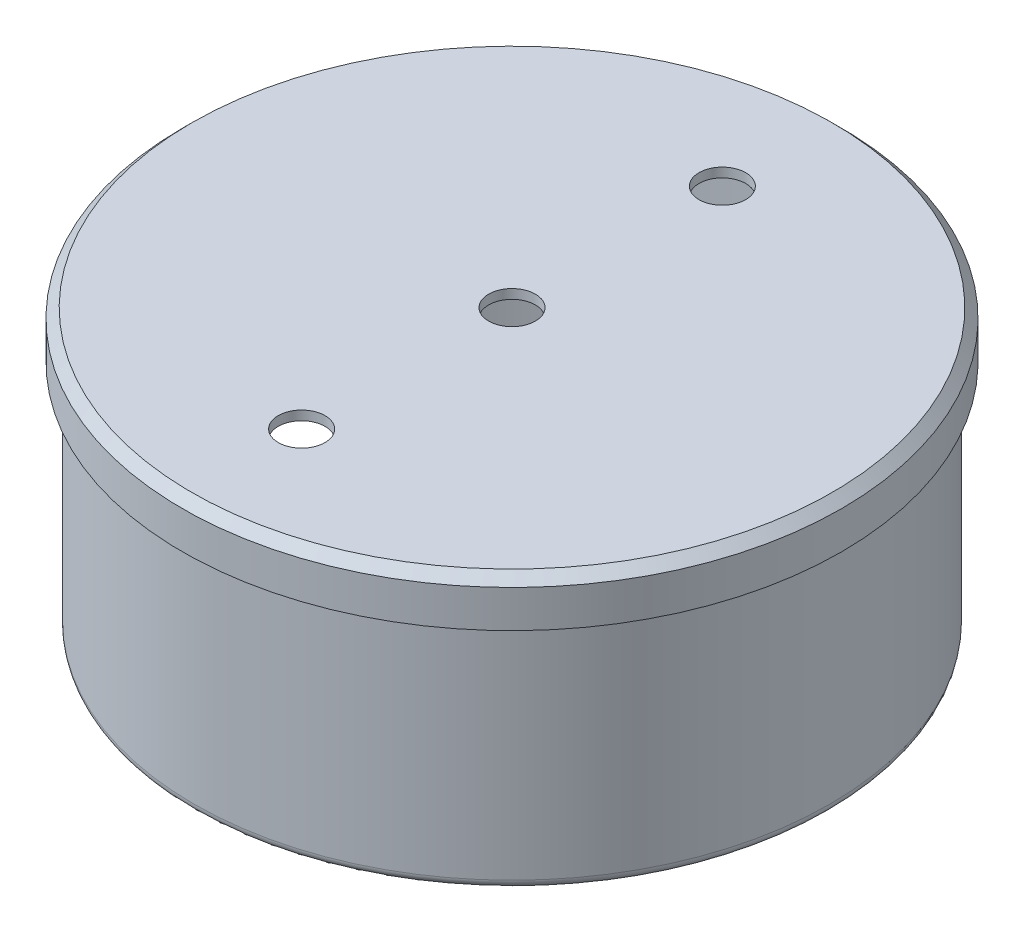
from build123d import *

# Parameters (mm, degrees)
SVUOTA5_START            = -60
SVUOTA5_OUTLINE_R        = 66
SVUOTA5_DEPTH            = 58
SVUOTA5_START_2          = -8
SVUOTA5_2_OUTLINE_R      = 68.499999813
SVUOTA5_2_OUTLINE_R_2    = 66
SVUOTA5_2_DEPTH          = 6
SMUSSO1_SIZE             = 2
SCHIZZO3_R               = 5
TAGLIO_ESTRUSIONE1_DEPTH = 10
SCHIZZO4_R               = 5
TAGLIO_ESTRUSIONE2_DEPTH = 10


# Read off the part's stored shape, not the designer's step: Svuota5
with BuildPart() as part:
    # Schizzo1 → Rivoluzione3 (revolve)
    with BuildSketch(Plane.XY):
        with BuildLine():
            Line((0, 0), (0, -10))
            Line((0, -10), (0, -60))
            Line((0, -60), (66, -60))
            ThreePointArc((66, -60), (67.414213562, -59.414213562), (68, -58))
            Line((68, -58), (68, -10))
            Line((68, -10), (70.499999813, -10))
            Line((70.499999813, -10), (70.499999813, 0))
            Line((70.499999813, 0), (0, 0))
        make_face()
    revolve(axis=Axis((0, -60, 0), (0, 1, 0)))

    # Svuota5 outline → Svuota5 (cut)
    with BuildSketch(Plane(origin=(0, 0, 0), x_dir=(1, 0, 0), z_dir=(0, 1, 0)).offset(SVUOTA5_START)):
        Circle(SVUOTA5_OUTLINE_R)
    extrude(amount=SVUOTA5_DEPTH, mode=Mode.SUBTRACT)

    # Svuota5 2 outline → Svuota5 2 (cut)
    with BuildSketch(Plane(origin=(0, 0, 0), x_dir=(1, 0, 0), z_dir=(0, 1, 0)).offset(SVUOTA5_START_2)):
        Circle(SVUOTA5_2_OUTLINE_R)
        Circle(SVUOTA5_2_OUTLINE_R_2, mode=Mode.SUBTRACT)
    extrude(amount=SVUOTA5_2_DEPTH, mode=Mode.SUBTRACT)

    # Smusso1
    smusso1_edges = [part.edges().sort_by_distance(p)[0] for p in [
        (-70.499999813, 0, 0),
    ]]
    chamfer(smusso1_edges, length=SMUSSO1_SIZE)

    # Schizzo3 → Taglio-Estrusione1 (cut)
    with BuildSketch(Plane(origin=(0, 0, 0), x_dir=(1, 0, 0), z_dir=(0, 1, 0))):
        with Locations(Location((0, 0, 0), (0, 0, 270))):
            Circle(SCHIZZO3_R)
    extrude(amount=-TAGLIO_ESTRUSIONE1_DEPTH, mode=Mode.SUBTRACT)

    # Schizzo4 → Taglio-Estrusione2 (cut)
    with BuildSketch(Plane(origin=(0, 0, 0), x_dir=(1, 0, 0), z_dir=(0, 1, 0))):
        with Locations(Location((0, 45, 0), (0, 0, 270))):
            Circle(SCHIZZO4_R)
        with Locations(Location((0, -45, 0), (0, 0, 270))):
            Circle(SCHIZZO4_R)
    extrude(amount=-TAGLIO_ESTRUSIONE2_DEPTH, mode=Mode.SUBTRACT)


solid = part.part
